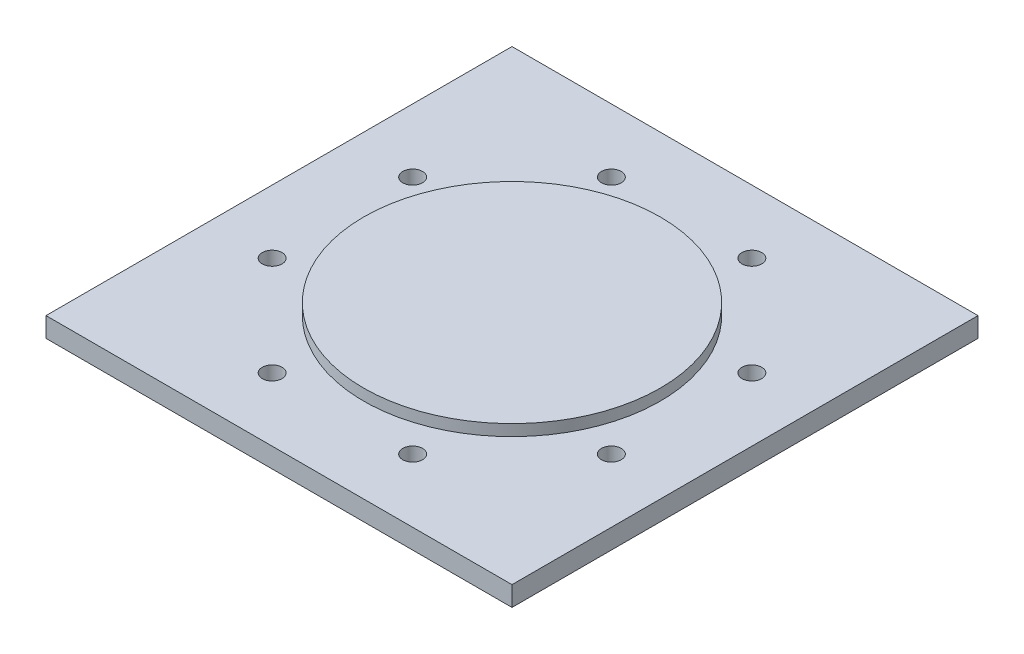
from build123d import *

# Parameters (mm, degrees)
F_01_BASE_PROFILE_W           = 330
F_01_BASE_PROFILE_H           = 330
F_01_BASE_PROFILE_R           = 7
F_01_BASE_PROFILE_R_2         = 5.248628476
F_01_BASE_PROFILE_R_3         = 5.751371524
F_01_BASE_EXTRUDE_DEPTH       = 14
F_02_BOSS_PROFILE_R           = 105
F_02_REINFORCEMENT_BOSS_DEPTH = 22


with BuildPart() as part:
    # 01_Base_Profile → 01_Base_Extrude (new body)
    with BuildSketch(Plane(origin=(0, 0, 0), x_dir=(1, 0, 0), z_dir=(0, 1, 0))):
        Rectangle(F_01_BASE_PROFILE_W, F_01_BASE_PROFILE_H)
        with Locations((120.104339226, 49.748846207)):
            Circle(F_01_BASE_PROFILE_R, mode=Mode.SUBTRACT)
        with Locations((49.748846207, 120.104339226)):
            Circle(F_01_BASE_PROFILE_R, mode=Mode.SUBTRACT)
        with Locations((-49.748846207, 120.104339226)):
            Circle(F_01_BASE_PROFILE_R, mode=Mode.SUBTRACT)
        with Locations((-120.104339226, 49.748846207)):
            Circle(F_01_BASE_PROFILE_R, mode=Mode.SUBTRACT)
        with Locations((-120.104339226, -49.748846207)):
            Circle(F_01_BASE_PROFILE_R, mode=Mode.SUBTRACT)
        with Locations((-49.748846207, -120.104339226)):
            Circle(F_01_BASE_PROFILE_R, mode=Mode.SUBTRACT)
        with Locations((49.748846207, -120.104339226)):
            Circle(F_01_BASE_PROFILE_R, mode=Mode.SUBTRACT)
        with Locations((120.104339226, -49.748846207)):
            Circle(F_01_BASE_PROFILE_R, mode=Mode.SUBTRACT)
        with Locations((49.748846207, 49.748846207)):
            Circle(F_01_BASE_PROFILE_R_2, mode=Mode.SUBTRACT)
        with Locations((-49.748846207, 49.748846207)):
            Circle(F_01_BASE_PROFILE_R_3, mode=Mode.SUBTRACT)
        with Locations((-49.748846207, -49.748846207)):
            Circle(F_01_BASE_PROFILE_R_3, mode=Mode.SUBTRACT)
        with Locations((49.748846207, -49.748846207)):
            Circle(F_01_BASE_PROFILE_R_2, mode=Mode.SUBTRACT)
    extrude(amount=F_01_BASE_EXTRUDE_DEPTH)

    # 02_Boss_Profile → 02_Reinforcement_Boss (add)
    with BuildSketch(Plane(origin=(0, 0, 0), x_dir=(1, 0, 0), z_dir=(0, 1, 0))):
        Circle(F_02_BOSS_PROFILE_R)
    extrude(amount=F_02_REINFORCEMENT_BOSS_DEPTH)


solid = part.part
